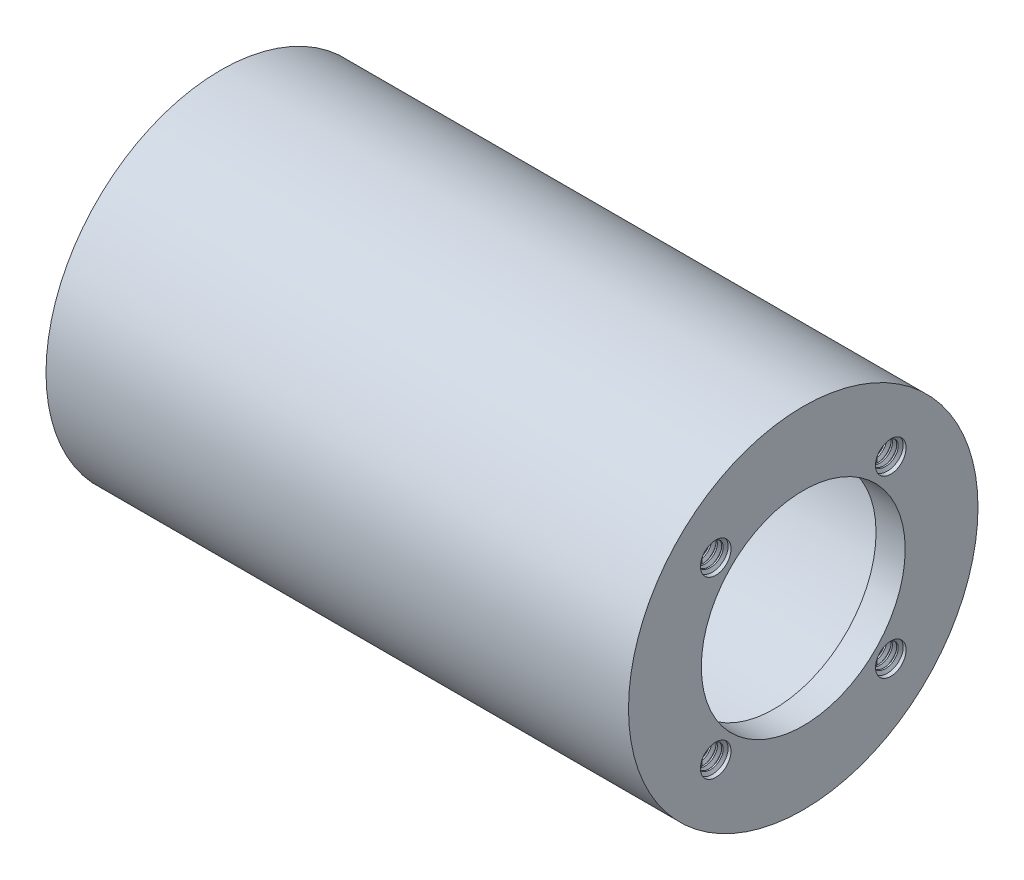
from build123d import *
from build123d.topology import SkipClean

# Parameters (mm, degrees)
SKETCH3_R           = 12
SKETCH3_R_2         = 7
BOSS_EXTRUDE1_DEPTH = 40
SKETCH4_R           = 11
CUT_EXTRUDE1_DEPTH  = 38
CUT_EXTRUDE2_START  = 40
SKETCH5_R           = 1.05
CUT_EXTRUDE2_DEPTH  = 84.451121965
THREAD1_PITCH       = 0.4
THREAD2_PITCH       = 0.4
THREAD3_PITCH       = 0.4
THREAD4_PITCH       = 0.4


with BuildPart() as part:
    # Sketch3 → Boss-Extrude1 (new body)
    with BuildSketch(Plane(origin=(0, 0, 0), x_dir=(0, 0, -1), z_dir=(1, 0, 0))):
        Circle(SKETCH3_R)
        Circle(SKETCH3_R_2, mode=Mode.SUBTRACT)
    extrude(amount=BOSS_EXTRUDE1_DEPTH)

    # Sketch4 → Cut-Extrude1 (cut)
    with BuildSketch(Plane(origin=(0, 0, 0), x_dir=(0, 0, -1), z_dir=(1, 0, 0))):
        Circle(SKETCH4_R)
    extrude(amount=CUT_EXTRUDE1_DEPTH, mode=Mode.SUBTRACT)

    # Sketch5 → Cut-Extrude2 (cut, through all)
    with BuildSketch(Plane(origin=(0, 0, 0), x_dir=(0, 0, -1), z_dir=(1, 0, 0)).offset(CUT_EXTRUDE2_START)):
        with Locations((6.01040764, 6.01040764)):
            Circle(SKETCH5_R)
        with Locations((6.01040764, -6.01040764)):
            Circle(SKETCH5_R)
        with Locations((-6.01040764, -6.01040764)):
            Circle(SKETCH5_R)
        with Locations((-6.01040764, 6.01040764)):
            Circle(SKETCH5_R)
    extrude(amount=-CUT_EXTRUDE2_DEPTH, mode=Mode.SUBTRACT)

    # Thread1: the profile of Thread Profile1 profile screwed along a right-hand helix of 5 turns, 6 arcs to a turn; built about Z, then put on its axis
    with SkipClean():  # the faces are left unmerged after this step: merging them gives an invalid solid
        thread1_z = Axis((0, 0, 0), (0, 0, 1))
        thread1_corners = [(1.0503, 0, -0.000173205), (1.0503, 0, 0.350173204), (0.83349365, 0, 0.224999999), (0.83349365, 0, 0.124999999)]
        with BuildLine(mode=Mode.PRIVATE) as thread1_profile:
            Line(thread1_corners[0], thread1_corners[1])
            Line(thread1_corners[1], thread1_corners[2])
            Line(thread1_corners[2], thread1_corners[3])
            Line(thread1_corners[3], thread1_corners[0])
        thread1_cap = Face(thread1_profile.wire())
        thread1_turn_angles = [0, 30, 60, 90, 120, 150, 180, 210, 240, 270, 300, 330, 360]
        thread1_turn_weights = [1, 0.8660254037844387, 1, 0.8660254037844387, 1, 0.8660254037844387, 1, 0.8660254037844387, 1, 0.8660254037844387, 1, 0.8660254037844387, 1]
        thread1_turn_rails = [Edge.make_bspline([Vector(p[0], p[1], 0).rotate(thread1_z, thread1_turn_angles[k]) / thread1_turn_weights[k] + Vector(0, 0, p[2] + THREAD1_PITCH * thread1_turn_angles[k] / 360) for k in range(13)], [0, 0, 0, 1, 1, 2, 2, 3, 3, 4, 4, 5, 5, 6, 6, 6], 2, thread1_turn_weights) for p in thread1_corners]
        thread1_turn_sides = [Face.make_surface_from_curves(thread1_turn_rails[p[0]], thread1_turn_rails[p[1]]) for p in [(0, 1), (1, 2), (2, 3), (3, 0)]]
        thread1 = Plane(origin=(40, 6.01040764, 6.01040764), x_dir=(0, 0, 1), z_dir=(-1, 0, 0)) * Solid(Shell([*[p.moved(Location((0, 0, THREAD1_PITCH * i))) for i in range(5) for p in thread1_turn_sides], thread1_cap, thread1_cap.rotate(thread1_z, 1800).moved(Location((0, 0, THREAD1_PITCH * 1800 / 360)))]))
        add(thread1)

    # Thread2: the profile of Thread Profile2 profile screwed along a right-hand helix of 5 turns, 6 arcs to a turn; built about Z, then put on its axis
    with SkipClean():  # the faces are left unmerged after this step: merging them gives an invalid solid
        thread2_z = Axis((0, 0, 0), (0, 0, 1))
        thread2_corners = [(1.0503, 0, -0.000173205), (1.0503, 0, 0.350173204), (0.83349365, 0, 0.224999999), (0.83349365, 0, 0.124999999)]
        with BuildLine(mode=Mode.PRIVATE) as thread2_profile:
            Line(thread2_corners[0], thread2_corners[1])
            Line(thread2_corners[1], thread2_corners[2])
            Line(thread2_corners[2], thread2_corners[3])
            Line(thread2_corners[3], thread2_corners[0])
        thread2_cap = Face(thread2_profile.wire())
        thread2_turn_angles = [0, 30, 60, 90, 120, 150, 180, 210, 240, 270, 300, 330, 360]
        thread2_turn_weights = [1, 0.8660254037844387, 1, 0.8660254037844387, 1, 0.8660254037844387, 1, 0.8660254037844387, 1, 0.8660254037844387, 1, 0.8660254037844387, 1]
        thread2_turn_rails = [Edge.make_bspline([Vector(p[0], p[1], 0).rotate(thread2_z, thread2_turn_angles[k]) / thread2_turn_weights[k] + Vector(0, 0, p[2] + THREAD2_PITCH * thread2_turn_angles[k] / 360) for k in range(13)], [0, 0, 0, 1, 1, 2, 2, 3, 3, 4, 4, 5, 5, 6, 6, 6], 2, thread2_turn_weights) for p in thread2_corners]
        thread2_turn_sides = [Face.make_surface_from_curves(thread2_turn_rails[p[0]], thread2_turn_rails[p[1]]) for p in [(0, 1), (1, 2), (2, 3), (3, 0)]]
        thread2 = Plane(origin=(40, 6.01040764, -6.01040764), x_dir=(0, 0, 1), z_dir=(-1, 0, 0)) * Solid(Shell([*[p.moved(Location((0, 0, THREAD2_PITCH * i))) for i in range(5) for p in thread2_turn_sides], thread2_cap, thread2_cap.rotate(thread2_z, 1800).moved(Location((0, 0, THREAD2_PITCH * 1800 / 360)))]))
        add(thread2)

    # Thread3: the profile of Thread Profile3 profile screwed along a right-hand helix of 5 turns, 6 arcs to a turn; built about Z, then put on its axis
    with SkipClean():  # the faces are left unmerged after this step: merging them gives an invalid solid
        thread3_z = Axis((0, 0, 0), (0, 0, 1))
        thread3_corners = [(1.0503, 0, -0.000173205), (1.0503, 0, 0.350173204), (0.83349365, 0, 0.224999999), (0.83349365, 0, 0.124999999)]
        with BuildLine(mode=Mode.PRIVATE) as thread3_profile:
            Line(thread3_corners[0], thread3_corners[1])
            Line(thread3_corners[1], thread3_corners[2])
            Line(thread3_corners[2], thread3_corners[3])
            Line(thread3_corners[3], thread3_corners[0])
        thread3_cap = Face(thread3_profile.wire())
        thread3_turn_angles = [0, 30, 60, 90, 120, 150, 180, 210, 240, 270, 300, 330, 360]
        thread3_turn_weights = [1, 0.8660254037844387, 1, 0.8660254037844387, 1, 0.8660254037844387, 1, 0.8660254037844387, 1, 0.8660254037844387, 1, 0.8660254037844387, 1]
        thread3_turn_rails = [Edge.make_bspline([Vector(p[0], p[1], 0).rotate(thread3_z, thread3_turn_angles[k]) / thread3_turn_weights[k] + Vector(0, 0, p[2] + THREAD3_PITCH * thread3_turn_angles[k] / 360) for k in range(13)], [0, 0, 0, 1, 1, 2, 2, 3, 3, 4, 4, 5, 5, 6, 6, 6], 2, thread3_turn_weights) for p in thread3_corners]
        thread3_turn_sides = [Face.make_surface_from_curves(thread3_turn_rails[p[0]], thread3_turn_rails[p[1]]) for p in [(0, 1), (1, 2), (2, 3), (3, 0)]]
        thread3 = Plane(origin=(40, -6.01040764, 6.01040764), x_dir=(0, 0, 1), z_dir=(-1, 0, 0)) * Solid(Shell([*[p.moved(Location((0, 0, THREAD3_PITCH * i))) for i in range(5) for p in thread3_turn_sides], thread3_cap, thread3_cap.rotate(thread3_z, 1800).moved(Location((0, 0, THREAD3_PITCH * 1800 / 360)))]))
        add(thread3)

    # Thread4: the profile of Thread Profile4 profile screwed along a right-hand helix of 5 turns, 6 arcs to a turn; built about Z, then put on its axis
    with SkipClean():  # the faces are left unmerged after this step: merging them gives an invalid solid
        thread4_z = Axis((0, 0, 0), (0, 0, 1))
        thread4_corners = [(1.0503, 0, -0.000173205), (1.0503, 0, 0.350173204), (0.83349365, 0, 0.224999999), (0.83349365, 0, 0.124999999)]
        with BuildLine(mode=Mode.PRIVATE) as thread4_profile:
            Line(thread4_corners[0], thread4_corners[1])
            Line(thread4_corners[1], thread4_corners[2])
            Line(thread4_corners[2], thread4_corners[3])
            Line(thread4_corners[3], thread4_corners[0])
        thread4_cap = Face(thread4_profile.wire())
        thread4_turn_angles = [0, 30, 60, 90, 120, 150, 180, 210, 240, 270, 300, 330, 360]
        thread4_turn_weights = [1, 0.8660254037844387, 1, 0.8660254037844387, 1, 0.8660254037844387, 1, 0.8660254037844387, 1, 0.8660254037844387, 1, 0.8660254037844387, 1]
        thread4_turn_rails = [Edge.make_bspline([Vector(p[0], p[1], 0).rotate(thread4_z, thread4_turn_angles[k]) / thread4_turn_weights[k] + Vector(0, 0, p[2] + THREAD4_PITCH * thread4_turn_angles[k] / 360) for k in range(13)], [0, 0, 0, 1, 1, 2, 2, 3, 3, 4, 4, 5, 5, 6, 6, 6], 2, thread4_turn_weights) for p in thread4_corners]
        thread4_turn_sides = [Face.make_surface_from_curves(thread4_turn_rails[p[0]], thread4_turn_rails[p[1]]) for p in [(0, 1), (1, 2), (2, 3), (3, 0)]]
        thread4 = Plane(origin=(40, -6.01040764, -6.01040764), x_dir=(0, 0, 1), z_dir=(-1, 0, 0)) * Solid(Shell([*[p.moved(Location((0, 0, THREAD4_PITCH * i))) for i in range(5) for p in thread4_turn_sides], thread4_cap, thread4_cap.rotate(thread4_z, 1800).moved(Location((0, 0, THREAD4_PITCH * 1800 / 360)))]))
        add(thread4)


solid = part.part
